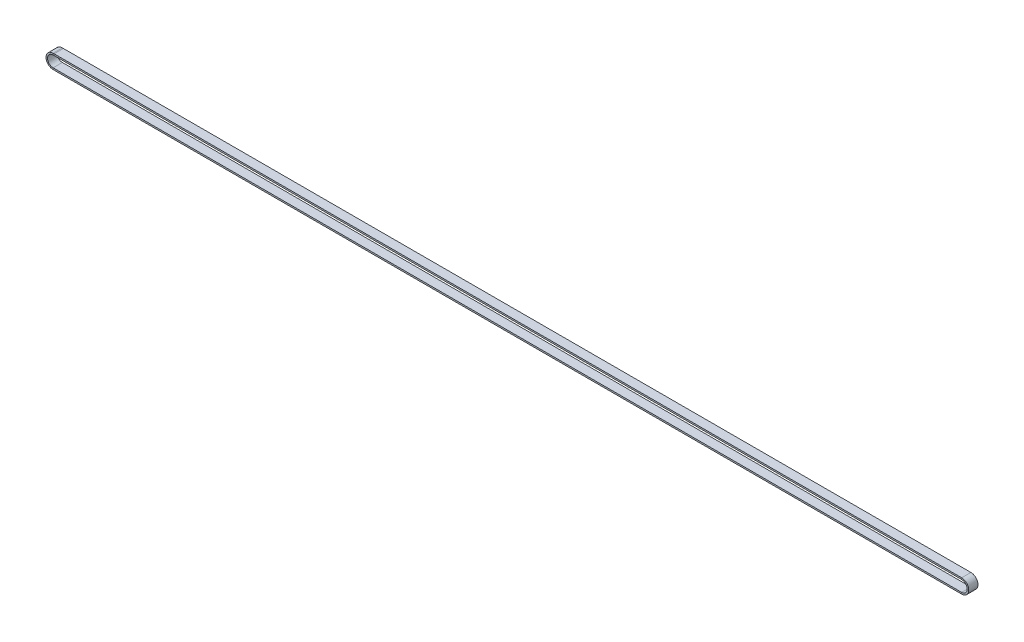
from build123d import *

# Parameters (mm, degrees)
SKETCH3_W = 9
SKETCH3_H = 1.5


with BuildPart() as part:
    # Sweep1: sweep along a path in Sketch2
    with BuildLine(Plane.XY.offset(-43.983366658)) as sweep1_path:
        Line((-1, -57.979692421), (883.520637828, -57.979692421))
        ThreePointArc((883.520637828, -57.979692421), (890.420637828, -64.879692421), (883.520637828, -71.779692421))
        Line((883.520637828, -71.779692421), (-1, -71.779692421))
        ThreePointArc((-1, -71.779692421), (-7.9, -64.879692421), (-1, -57.979692421))
    # Sketch3 → Sweep1 (sweep)
    with BuildSketch(Plane(origin=(0, 0, 0), x_dir=(0, 0, -1), z_dir=(1, 0, 0))):
        with Locations((39.483366658, -58.729692421)):
            Rectangle(SKETCH3_W, SKETCH3_H)
    sweep(path=sweep1_path.line)


solid = part.part
